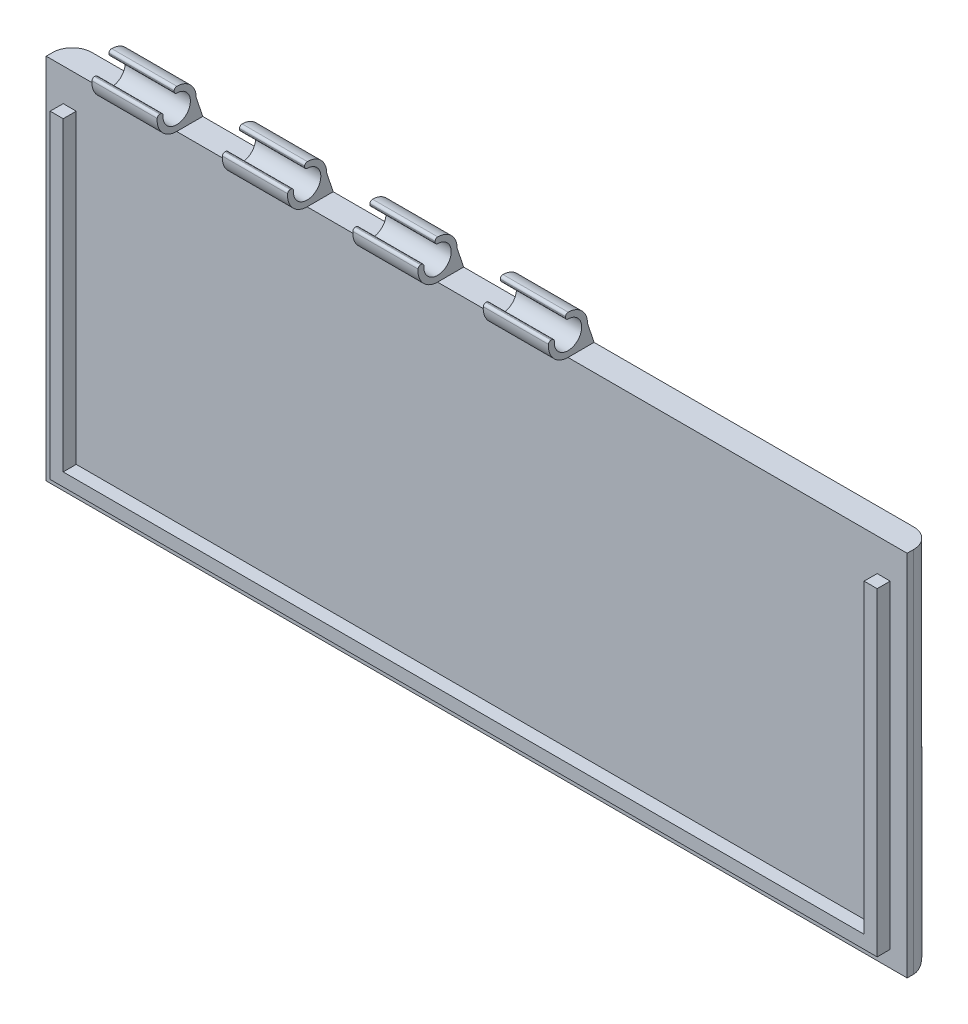
from build123d import *
from OCP.BRepAlgoAPI import BRepAlgoAPI_Cut
from OCP.TopTools import TopTools_ListOfShape

# Parameters (mm, degrees)
SKETCH1_W              = 66
SKETCH1_H              = 28.2
BOSS_EXTRUDE1_DEPTH    = 2
SKETCH5_R              = 1.0500000000000005
BOSS_EXTRUDE2_DEPTH    = 5
SKETCH8_W              = 1.7595642605370743
SKETCH8_H              = 1.7595642605370756
CUT_EXTRUDE3_DEPTH     = 5
FILLET4_R              = 0.2
LPATTERN1_COUNT        = 8
LPATTERN1_PITCH        = 5
LPATTERN1_2_COUNT      = 8
LPATTERN1_2_PITCH      = 5
FILLET4_OF_LPATTERN1_R = 0.2
CUT_EXTRUDE1_DEPTH     = 44.54870836201689
FILLET5_R              = 1.5
BOSS_EXTRUDE3_DEPTH    = 1


with BuildPart() as part:
    # Sketch1 → Boss-Extrude1 (new body)
    with BuildSketch(Plane.XY):
        Rectangle(SKETCH1_W, SKETCH1_H)
    extrude(amount=BOSS_EXTRUDE1_DEPTH)


with BuildPart() as body_2:
    # Sketch5 → Boss-Extrude2 (new body)
    with BuildSketch(Plane.ZY.offset(33)):
        with BuildLine():
            Line((0.5, 15.599999999999998), (0, 14.099999999999998))
            Line((0, 14.099999999999998), (2, 14.099999999999998))
            ThreePointArc((2, 14.099999999999998), (3.0606601717798214, 16.66066017177982), (0.5, 15.599999999999998))
        make_face()
        with Locations((2, 15.599999999999998)):
            Circle(SKETCH5_R, mode=Mode.SUBTRACT)
    boss_extrude2 = extrude(amount=-BOSS_EXTRUDE2_DEPTH)

    # Sketch8 → Cut-Extrude3 (cut)
    with BuildSketch(Plane.ZY.offset(33)):
        with Locations((3.068777942853419, 16.780207609912114)):
            Rectangle(SKETCH8_W, SKETCH8_H)
    cut_extrude3 = extrude(amount=-CUT_EXTRUDE3_DEPTH, mode=Mode.SUBTRACT)

    # Fillet4
    fillet4_edges = [body_2.edges().sort_by_distance(p)[0] for p in [
        (-30.5, 16.632850706939475, 2.1889958125848823),
        (-30.5, 15.900425479643578, 3.006103638389667),
        (-30.5, 17.08804589405884, 2.1889958125848823),
        (-30.5, 15.900425479643578, 3.4696069308427098),
    ]]
    fillet(fillet4_edges, radius=FILLET4_R)


with BuildPart() as part_1:
    add(part.part)

    add(body_2.part)  # LPattern1 merges body 2
    # LPattern1: Boss-Extrude2 ×8, 3 skipped
    with Locations(*[(i * LPATTERN1_PITCH, 0, 0) for i in range(1, LPATTERN1_COUNT) if i not in (2, 4, 6)]):
        add(boss_extrude2)

    # LPattern1 2: Cut-Extrude3 ×8, 3 skipped
    with Locations(*[(i * LPATTERN1_2_PITCH, 0, 0) for i in range(1, LPATTERN1_2_COUNT) if i not in (2, 4, 6)]):
        add(cut_extrude3, mode=Mode.SUBTRACT)

    # Fillet4 of LPattern1
    fillet4_of_lpattern1_edges = [part_1.edges().sort_by_distance(p)[0] for p in [
        (-25.5, 16.632850706939475, 2.1889958125848823),
        (-25.5, 15.900425479643578, 3.006103638389667),
        (-25.5, 17.08804589405884, 2.1889958125848823),
        (-25.5, 15.900425479643578, 3.4696069308427098),
        (-15.5, 16.632850706939475, 2.1889958125848823),
        (-15.5, 15.900425479643578, 3.006103638389667),
        (-15.5, 17.08804589405884, 2.1889958125848823),
        (-15.5, 15.900425479643578, 3.4696069308427098),
        (-5.5, 16.632850706939475, 2.1889958125848823),
        (-5.5, 15.900425479643578, 3.006103638389667),
        (-5.5, 17.08804589405884, 2.1889958125848823),
        (-5.5, 15.900425479643578, 3.4696069308427098),
        (4.5, 16.632850706939475, 2.1889958125848823),
        (4.5, 15.900425479643578, 3.006103638389667),
        (4.5, 17.08804589405884, 2.1889958125848823),
        (4.5, 15.900425479643578, 3.4696069308427098),
    ]]
    fillet(fillet4_of_lpattern1_edges, radius=FILLET4_OF_LPATTERN1_R)


with BuildPart() as cut_extrude1_tool:
    # Sketch6 → Cut-Extrude1 (new, through all)
    with BuildSketch(Plane(origin=(0, 14.099999999999998, 0), x_dir=(1, 0, 0), z_dir=(0, 1, 0))):
        Polygon((-33, 0), (-28, 0), (-28, -7.434056861178039), (-33, -7.434056861178038), align=None)
    extrude(amount=CUT_EXTRUDE1_DEPTH)


with BuildPart() as part_2:
    add(part_1.part)

    # Cut-Extrude1: cut by cut_extrude1_tool, with a tolerance
    cut_extrude1_stock = TopTools_ListOfShape()
    cut_extrude1_stock.Append(part_2.part.wrapped)
    cut_extrude1_tools = TopTools_ListOfShape()
    cut_extrude1_tools.Append(cut_extrude1_tool.part.wrapped)
    cut_extrude1_cut = BRepAlgoAPI_Cut()
    cut_extrude1_cut.SetArguments(cut_extrude1_stock)
    cut_extrude1_cut.SetTools(cut_extrude1_tools)
    cut_extrude1_cut.SetFuzzyValue(0.00001)
    cut_extrude1_cut.Build()
    add(Compound.cast(cut_extrude1_cut.Shape()).solids(), mode=Mode.REPLACE)

    # Fillet5
    fillet5_edges = [part_2.edges().sort_by_distance(p)[0] for p in [
        (0, -14.100000000000001, 0),
        (-33, -1.78e-15, 0),
        (33, -1.78e-15, 0),
    ]]
    fillet(fillet5_edges, radius=FILLET5_R)

    # Sketch9 → Boss-Extrude3 (add)
    with BuildSketch(Plane.XY.offset(2)):
        Polygon((-31.7, 11.599999999999998), (-30.7, 11.599999999999998), (-30.699999999999996, -11.85000000000001), (30.7, -11.85000000000001), (30.7, 11.599999999999994), (31.7, 11.599999999999996), (31.7, -11.850000000000012), (31.700000000000006, -12.850000000000001), (-30.7, -12.85000000000001), (-31.7, -12.850000000000009), align=None)
    extrude(amount=BOSS_EXTRUDE3_DEPTH)


solid = part_2.part
